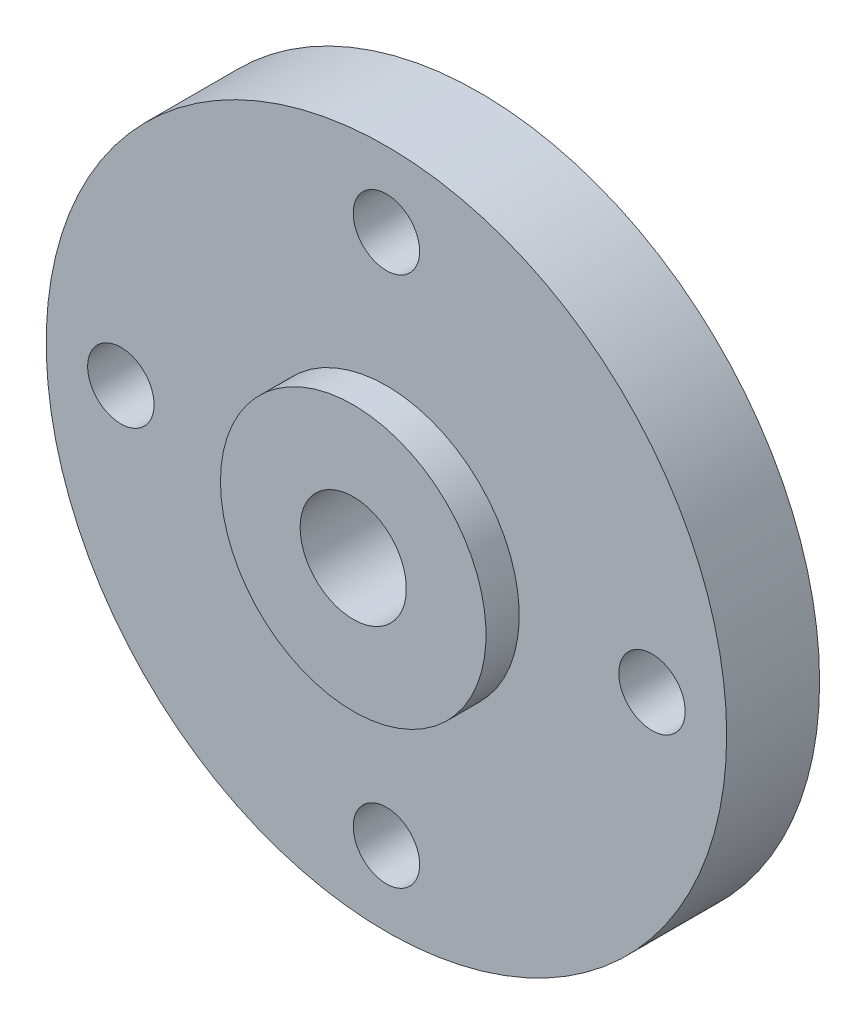
from build123d import *

# Parameters (mm, degrees)
SKETCH1_R           = 10.25
SKETCH1_R_2         = 4
BOSS_EXTRUDE1_DEPTH = 2.8
SKETCH1_3_R         = 4
SKETCH1_3_R_2       = 1.6
BOSS_EXTRUDE2_DEPTH = 3.8
SKETCH2_R           = 1
CUT_EXTRUDE1_DEPTH  = 2.8


with BuildPart() as part:
    # Sketch1 → Boss-Extrude1 (new body)
    with BuildSketch(Plane.XY):
        Circle(SKETCH1_R)
        Circle(SKETCH1_R_2, mode=Mode.SUBTRACT)
    extrude(amount=BOSS_EXTRUDE1_DEPTH)

    # Sketch1<3> → Boss-Extrude2 (add)
    with BuildSketch(Plane.XY):
        Circle(SKETCH1_3_R)
        Circle(SKETCH1_3_R_2, mode=Mode.SUBTRACT)
    extrude(amount=BOSS_EXTRUDE2_DEPTH)

    # Sketch2 → Cut-Extrude1 (cut)
    with BuildSketch(Plane.XY.offset(2.8)):
        with Locations((8, 0)):
            Circle(SKETCH2_R)
        with Locations((0, 8)):
            Circle(SKETCH2_R)
        with Locations((0, -8)):
            Circle(SKETCH2_R)
        with Locations((-8, 0)):
            Circle(SKETCH2_R)
    extrude(amount=-CUT_EXTRUDE1_DEPTH, mode=Mode.SUBTRACT)


solid = part.part
